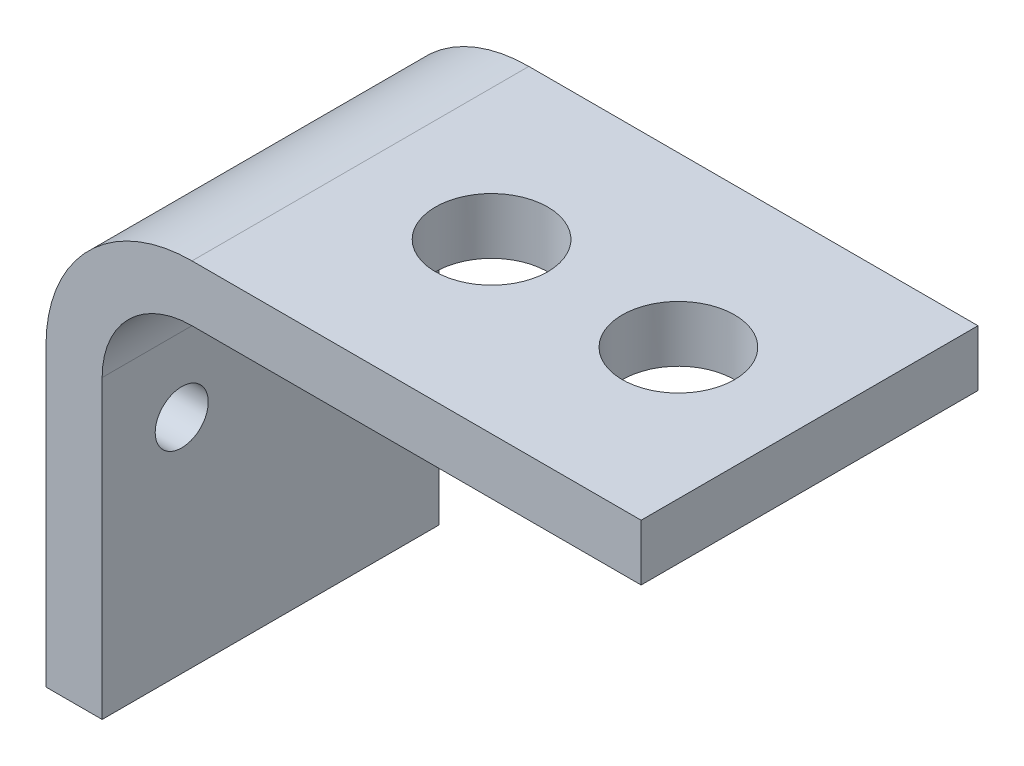
from build123d import *

# Parameters (mm, degrees)
BOSS_EXTRUDE1_DEPTH = 9.525
CUT_EXTRUDE1_REACH  = 23.891
SKETCH2_R           = 0.75
SKETCH3_R           = 1.5875
CUT_EXTRUDE2_DEPTH  = 2.54


with BuildPart() as part:
    # Sketch1 → Boss-Extrude1 (new body)
    with BuildSketch(Plane.XY):
        with BuildLine():
            Line((0, 0), (0, 8.3725))
            ThreePointArc((0, 8.3725), (0.743948776, 10.168551224), (2.54, 10.9125))
            Line((2.54, 10.9125), (15.24, 10.9125))
            Line((15.24, 10.9125), (15.24, 12.5))
            Line((15.24, 12.5), (2.54, 12.5))
            ThreePointArc((2.54, 12.5), (-0.378583239, 11.291083239), (-1.5875, 8.3725))
            Line((-1.5875, 8.3725), (-1.5875, 0))
            Line((-1.5875, 0), (0, 0))
        make_face()
    extrude(amount=BOSS_EXTRUDE1_DEPTH)

    # Sketch2 → Cut-Extrude1 (cut, up to next)
    with BuildSketch(Plane(origin=(0, 0, 0), x_dir=(0, 0, -1), z_dir=(1, 0, 0)), mode=Mode.PRIVATE) as cut_extrude1_sk1:
        with Locations((-7.275, 6.277)):
            Circle(SKETCH2_R)
    cut_extrude1_tool1 = extrude(cut_extrude1_sk1.sketch, amount=-CUT_EXTRUDE1_REACH, mode=Mode.PRIVATE) & part.part
    add(cut_extrude1_tool1.solids().sort_by_distance((0, 6.277, 7.275))[0], mode=Mode.SUBTRACT)

    # Sketch3 → Cut-Extrude2 (cut)
    with BuildSketch(Plane.XZ.offset(-10.9125)):
        with Locations((11.5316, 4.7625)):
            Circle(SKETCH3_R)
        with Locations((6.2484, 4.7625)):
            Circle(SKETCH3_R)
    extrude(amount=-CUT_EXTRUDE2_DEPTH, mode=Mode.SUBTRACT)


solid = part.part
